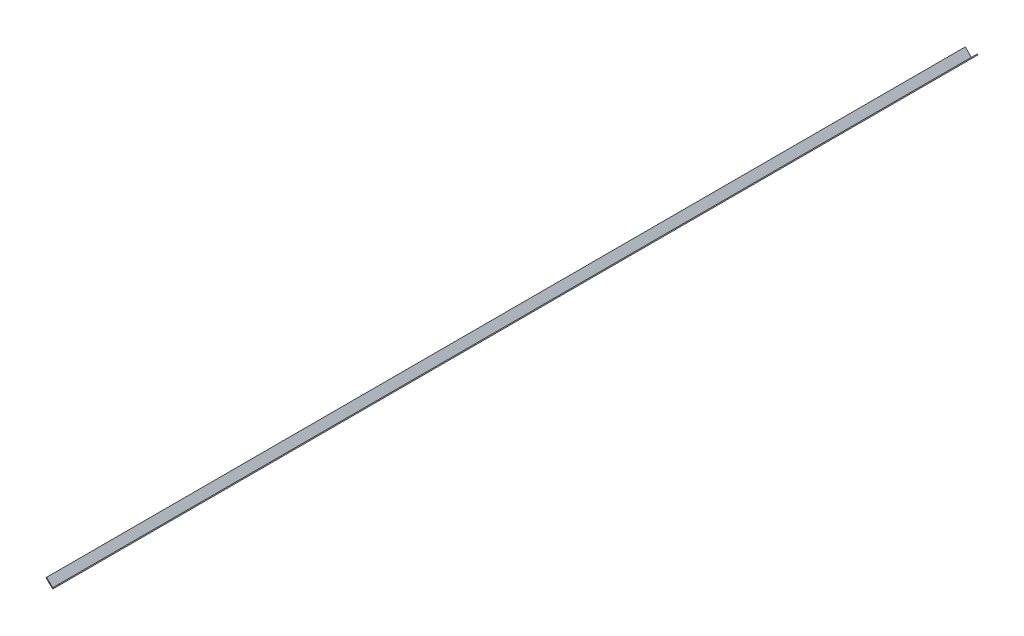
from build123d import *

# Parameters (mm, degrees)
BOSS_EXTRUDE1_DEPTH      = 1289.05
BOSS_EXTRUDE1_DEPTH_BACK = 76.2


with BuildPart() as part:
    # Sketch1 → Boss-Extrude1 (new, two sides: drawn at the far end of the back side and taken through both)
    with BuildSketch(Plane.XY.offset(-BOSS_EXTRUDE1_DEPTH_BACK)):
        Polygon((0, 0), (-8.980256121, 8.980256121), (-9.878281733, 8.082230509), (0, -1.796051224), (9.878281733, 8.082230509), (8.980256121, 8.980256121), align=None)
    extrude(amount=BOSS_EXTRUDE1_DEPTH + BOSS_EXTRUDE1_DEPTH_BACK)


solid = part.part
